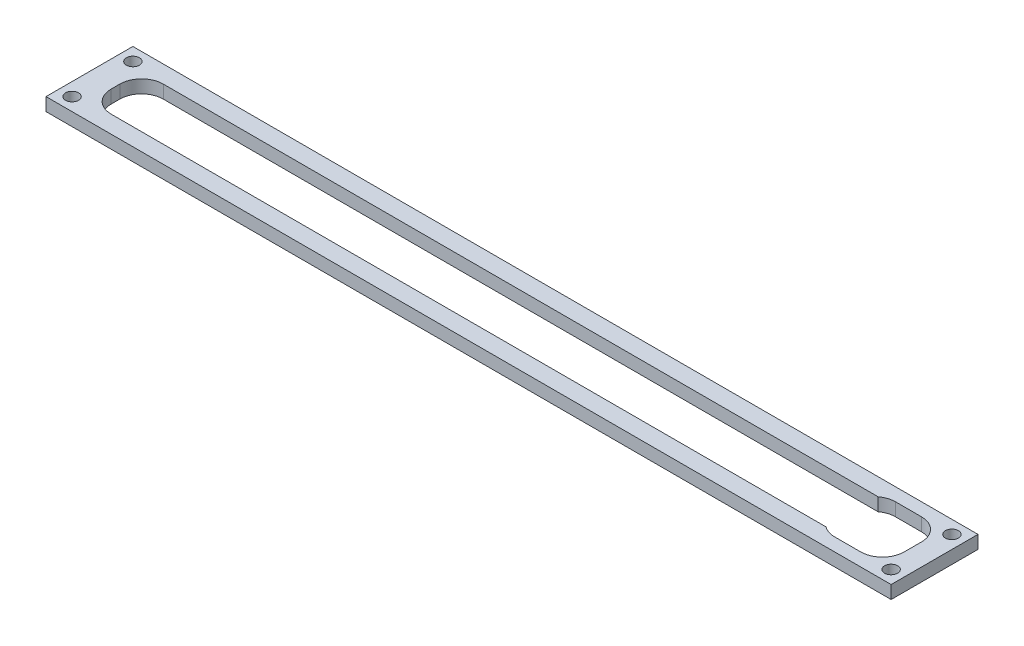
from build123d import *

# Parameters (mm, degrees)
SKETCH1_W           = 194.591670797
SKETCH1_H           = 20
SKETCH1_R           = 1.5
SKETCH1_W_2         = 182.591670797
SKETCH1_H_2         = 12
BOSS_EXTRUDE1_DEPTH = 3
CUT_EXTRUDE1_DEPTH  = 196.639766774
FILLET1_R           = 5


with BuildPart() as part:
    # Sketch1 → Boss-Extrude1 (new body)
    with BuildSketch(Plane(origin=(0, 0, 0), x_dir=(1, 0, 0), z_dir=(0, 1, 0))):
        with Locations((97.295835399, 10)):
            Rectangle(SKETCH1_W, SKETCH1_H)
        with Locations(Location((3, 17, 0), (0, 0, 270))):
            Circle(SKETCH1_R, mode=Mode.SUBTRACT)
        with Locations(Location((3, 3, 0), (0, 0, 90))):
            Circle(SKETCH1_R, mode=Mode.SUBTRACT)
        with Locations(Location((191.591670797, 3, 0), (0, 0, 270))):
            Circle(SKETCH1_R, mode=Mode.SUBTRACT)
        with Locations(Location((191.591670797, 17, 0), (0, 0, 90))):
            Circle(SKETCH1_R, mode=Mode.SUBTRACT)
        with Locations((97.295835399, 10)):
            Rectangle(SKETCH1_W_2, SKETCH1_H_2, mode=Mode.SUBTRACT)
    extrude(amount=BOSS_EXTRUDE1_DEPTH)

    # Sketch2 → Cut-Extrude1 (cut, through all)
    with BuildSketch(Plane(origin=(0, 3, 0), x_dir=(1, 0, 0), z_dir=(0, 1, 0))):
        Polygon((175.591670797, 17), (175.591670797, 16), (188.591670797, 16), (188.591670797, 4), (175.591670797, 4), (175.591670797, 3), (189.591670797, 3), (189.591670797, 17), align=None)
    extrude(amount=-CUT_EXTRUDE1_DEPTH, mode=Mode.SUBTRACT)

    # Fillet1
    # the kernel refuses this fillet: 5 mm, written as the material it adds along each edge
    with BuildSketch(Plane(origin=(189.591670797, 3, -17), x_dir=(0, 0, 1), z_dir=(0, -1, 0)), Plane(origin=(189.591670797, 3, -3), x_dir=(-1, 0, 0), z_dir=(0, -1, 0)), Plane(origin=(6, 0, -16), x_dir=(0, 0, 1), z_dir=(0, 1, 0))) as fillet1_piece_1:
        with BuildLine():
            CenterArc((FILLET1_R, FILLET1_R), FILLET1_R, 180, 90)
            Line((0, FILLET1_R), (-FILLET1_R * 0.02, FILLET1_R))
            Line((-FILLET1_R * 0.02, FILLET1_R), (-FILLET1_R * 0.02, -FILLET1_R * 0.02))
            Line((-FILLET1_R * 0.02, -FILLET1_R * 0.02), (FILLET1_R, -FILLET1_R * 0.02))
            Line((FILLET1_R, -FILLET1_R * 0.02), (FILLET1_R, 0))
        make_face()
    extrude(amount=3)
    with BuildSketch(Plane(origin=(175.591670797, 3, -17), x_dir=(1, 0, 0), z_dir=(0, -1, 0))) as fillet1_piece_2:
        with BuildLine():
            CenterArc((3, 5), FILLET1_R, 233.130102354, 36.869897646)
            Line((0, 1), (-0.06, 0.92))
            ThreePointArc((-0.06, 0.92), (-0.1, 0.5), (-0.1, 0))
            Line((-0.1, 0), (0, -0.1))
            Line((0, -0.1), (3, -0.1))
            Line((3, -0.1), (3, 0))
        make_face()
    extrude(amount=3)
    with BuildSketch(Plane(origin=(175.591670797, 3, -3), x_dir=(0, 0, -1), z_dir=(0, -1, 0))) as fillet1_piece_3:
        with BuildLine():
            CenterArc((5, 3), FILLET1_R, 180, 36.869897646)
            Line((0, 3), (-0.1, 3))
            Line((-0.1, 3), (-0.1, 0))
            Line((-0.1, 0), (0, -0.1))
            ThreePointArc((0, -0.1), (0.5, -0.1), (0.92, -0.06))
            Line((0.92, -0.06), (1, 0))
        make_face()
    extrude(amount=3)
    with BuildSketch(Plane(origin=(6, 0, -4), x_dir=(0, 0, -1), z_dir=(0, 1, 0))) as fillet1_piece_4:
        with BuildLine():
            CenterArc((FILLET1_R, -FILLET1_R), FILLET1_R, 90, 90)
            Line((0, -FILLET1_R), (-FILLET1_R * 0.02, -FILLET1_R))
            Line((-FILLET1_R * 0.02, -FILLET1_R), (-FILLET1_R * 0.02, FILLET1_R * 0.02))
            Line((-FILLET1_R * 0.02, FILLET1_R * 0.02), (FILLET1_R, FILLET1_R * 0.02))
            Line((FILLET1_R, FILLET1_R * 0.02), (FILLET1_R, 0))
        make_face()
    extrude(amount=3)


solid = part.part
